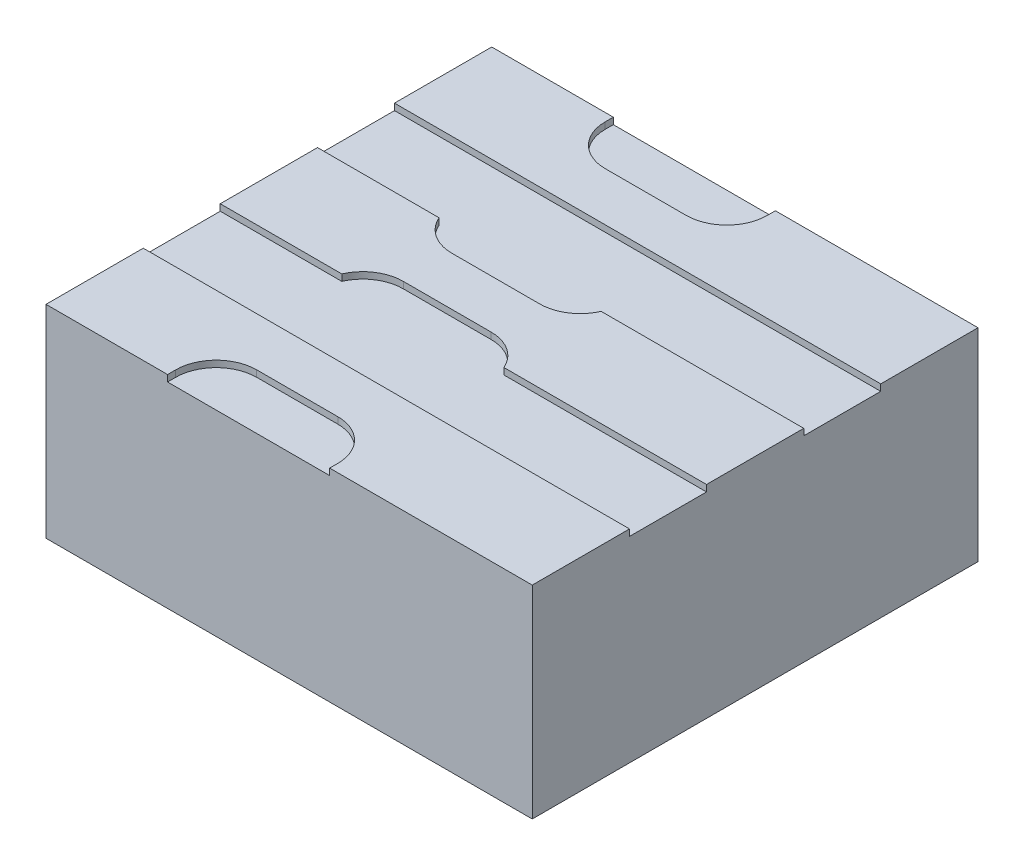
from build123d import *

# Parameters (mm, degrees)
SKETCH1_W           = 6
SKETCH1_H           = 2.5
BOSS_EXTRUDE1_DEPTH = 2.75
SKETCH3_OUTSIDE_W   = 9.702
SKETCH3_OUTSIDE_H   = 9.202
SKETCH3_OUTSIDE_W_2 = 4
SKETCH3_OUTSIDE_H_2 = 0.6
CUT_EXTRUDE1_DEPTH  = 0.08
SKETCH7_W           = 1.5
SKETCH7_H           = 1.2
SKETCH7_W_2         = 2.5
BOSS_EXTRUDE3_DEPTH = 0.2
FILLET2_R           = 0.5


with BuildPart() as part:
    # Sketch1 → Boss-Extrude1 (new, symmetric)
    with BuildSketch(Plane.XY):
        Rectangle(SKETCH1_W, SKETCH1_H)
    extrude(amount=BOSS_EXTRUDE1_DEPTH, both=True)

    # Sketch3 outside → Cut-Extrude1 (cut)
    with BuildSketch(Plane(origin=(0, 1.25, 0), x_dir=(1, 0, 0), z_dir=(0, 1, 0))):
        Rectangle(SKETCH3_OUTSIDE_W, SKETCH3_OUTSIDE_H)
        with Locations((0, 1.85)):
            Rectangle(SKETCH3_OUTSIDE_W_2, SKETCH3_OUTSIDE_H_2, mode=Mode.SUBTRACT)
        with Locations((0, -1.85)):
            Rectangle(SKETCH3_OUTSIDE_W_2, SKETCH3_OUTSIDE_H_2, mode=Mode.SUBTRACT)
        Rectangle(SKETCH3_OUTSIDE_W_2, SKETCH3_OUTSIDE_H_2, mode=Mode.SUBTRACT)
    extrude(amount=-CUT_EXTRUDE1_DEPTH, mode=Mode.SUBTRACT)

    # Sketch7 → Boss-Extrude3 (add)
    with BuildSketch(Plane(origin=(0, 1.25, 0), x_dir=(1, 0, 0), z_dir=(0, 1, 0))):
        with Locations((-2.25, 2.15)):
            Rectangle(SKETCH7_W, SKETCH7_H)
        with Locations((-2.25, -2.15)):
            Rectangle(SKETCH7_W, SKETCH7_H)
        with Locations((1.75, 2.15)):
            Rectangle(SKETCH7_W_2, SKETCH7_H)
        with Locations((1.75, -2.15)):
            Rectangle(SKETCH7_W_2, SKETCH7_H)
        with Locations((-2.25, 0)):
            Rectangle(SKETCH7_W, SKETCH7_H)
        with Locations((1.75, 0)):
            Rectangle(SKETCH7_W_2, SKETCH7_H)
    extrude(amount=-BOSS_EXTRUDE3_DEPTH)

    # Fillet2
    # the kernel refuses this fillet: 0.5 mm, written as the material it adds along each edge
    with BuildSketch(Plane(origin=(0.5, 1.25, -2.15), x_dir=(-1, 0, 0), z_dir=(0, -1, 0)), Plane(origin=(0.5, -0.08, 2.15), x_dir=(-1, 0, 0), z_dir=(0, 1, 0)), Plane(origin=(-1.5, 1.25, -2.15), x_dir=(0, 0, -1), z_dir=(0, -1, 0)), Plane(origin=(-1.5, -0.08, 2.15), x_dir=(0, 0, 1), z_dir=(0, 1, 0))) as fillet2_piece_1:
        with BuildLine():
            CenterArc((FILLET2_R, FILLET2_R), FILLET2_R, 180, 90)
            Line((0, FILLET2_R), (-FILLET2_R * 0.02, FILLET2_R))
            Line((-FILLET2_R * 0.02, FILLET2_R), (-FILLET2_R * 0.02, -FILLET2_R * 0.02))
            Line((-FILLET2_R * 0.02, -FILLET2_R * 0.02), (FILLET2_R, -FILLET2_R * 0.02))
            Line((FILLET2_R, -FILLET2_R * 0.02), (FILLET2_R, 0))
        make_face()
    extrude(amount=1.33)
    with BuildSketch(Plane(origin=(-1.5, 0.024356076, -0.3), x_dir=(1, 0, 0), z_dir=(0, 1, 0)), Plane(origin=(0.5, 0.024356076, 0.3), x_dir=(-1, 0, 0), z_dir=(0, 1, 0))) as fillet2_piece_2:
        with BuildLine():
            CenterArc((0.458257569, 0.5), FILLET2_R, 203.578178478, 66.421821522)
            Line((0, 0.3), (-0.009165151, 0.296))
            ThreePointArc((-0.009165151, 0.296), (-0.01, 0.15), (-0.01, 0))
            Line((-0.01, 0), (0, -0.01))
            Line((0, -0.01), (0.458257569, -0.01))
            Line((0.458257569, -0.01), (0.458257569, 0))
        make_face()
    extrude(amount=1.225643924)
    with BuildSketch(Plane(origin=(-1.5, 1.25, 0.3), x_dir=(0, 0, 1), z_dir=(0, -1, 0)), Plane(origin=(0.5, 1.25, -0.3), x_dir=(0, 0, -1), z_dir=(0, -1, 0))) as fillet2_piece_3:
        with BuildLine():
            CenterArc((0.5, -0.458257569), FILLET2_R, 113.578178478, 66.421821522)
            Line((0, -0.458257569), (-0.01, -0.458257569))
            Line((-0.01, -0.458257569), (-0.01, 0))
            Line((-0.01, 0), (0, 0.01))
            ThreePointArc((0, 0.01), (0.15, 0.01), (0.296, 0.009165151))
            Line((0.296, 0.009165151), (0.3, 0))
        make_face()
    extrude(amount=1.225643924)


solid = part.part
